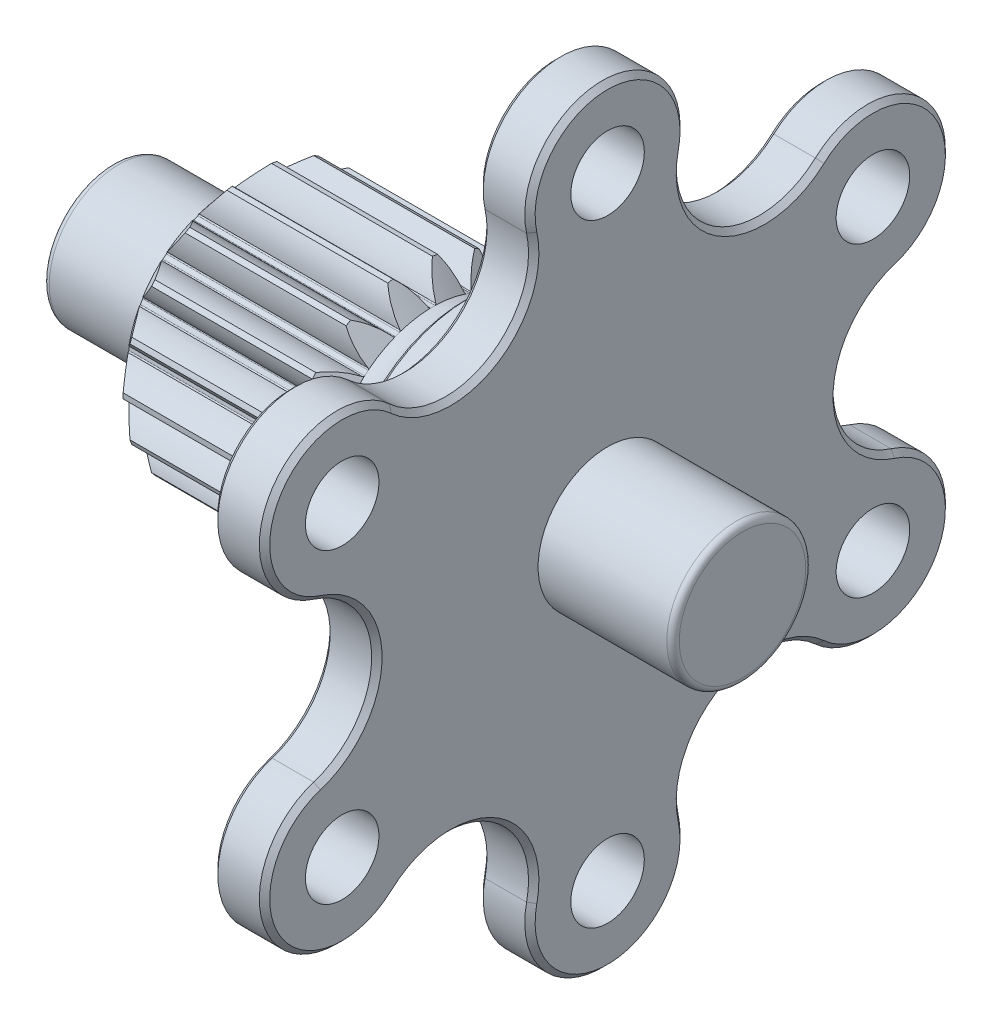
from build123d import *
from OCP.BRepFilletAPI import BRepFilletAPI_MakeChamfer

# Parameters (mm, degrees)
SKETCH1_R              = 47
BASE_EXTRUDE_DEPTH     = 6.35
M8_CLEARANCE_HOLES_D   = 9
CIRPATTERN_COUNT       = 6
CUT_EXTRUDE_DEPTH      = 67.770670957
CUT_EXTRUDE_DEPTH_BACK = 67.770670957
CHAMFER1_SIZE          = 0.635
SKETCH8_R              = 15.748
SHAFT_EXTRUDE_DEPTH    = 52.5820005
CHAMFER3_SIZE          = 0.635
SHAFT_CHAMFER_SIZE     = 1
CUT_EXTRUDE1_START     = -12.856999432
SKETCH45_R             = 15.748
SKETCH45_R_2           = 8.5127
CUT_EXTRUDE1_DEPTH     = 12.856999432
SKETCH55_R             = 8.5
BOSS_EXTRUDE4_DEPTH    = 16.51
SKETCH56_R             = 8.5127
BOSS_EXTRUDE5_DEPTH    = 1.643
FILLET9_R              = 1.524
CUT_EXTRUDE17_START    = -25.4
CUT_EXTRUDE17_DEPTH    = 25.4
CHAMFER6_SIZE          = 2.54
CHAMFER6_SIZE2         = 3.027054125
FILLET10_R             = 1.27
FILLET11_R             = 0.762
FILLET12_R             = 0.762
CHAMFER7_SIZE          = 0.508


with BuildPart() as part:
    # Sketch1 → Base-Extrude (new body)
    with BuildSketch(Plane(origin=(0, 0, 0), x_dir=(0, 0, -1), z_dir=(1, 0, 0))):
        Circle(SKETCH1_R)
    extrude(amount=-BASE_EXTRUDE_DEPTH)

    # M8 Clearance Holes (through all)
    with Locations(Plane(origin=(0, 0, 0), x_dir=(0, 0, -1), z_dir=(1, 0, 0))):
        with Locations((0, -37.5)):
            m8_clearance_holes = Hole(M8_CLEARANCE_HOLES_D / 2)

    # CirPattern: M8 Clearance Holes ×6 about axis
    cirpattern_axis = Axis((0, 0, 0), (1, 0, 0))
    for i in range(1, CIRPATTERN_COUNT):
        add(m8_clearance_holes.rotate(cirpattern_axis, i * 360 / CIRPATTERN_COUNT), mode=Mode.SUBTRACT)

    # Sketch19 → Cut-Extrude (cut, two sides: drawn at the far end of the back side and taken through both)
    with BuildSketch(Plane(origin=(0, 0, 0), x_dir=(0, 0, -1), z_dir=(1, 0, 0)).offset(-CUT_EXTRUDE_DEPTH_BACK)):
        with BuildLine():
            ThreePointArc((9.274838239, 35.443941724), (14.114033661, 24.446223401), (26.057934823, 25.754216393))
            ThreePointArc((26.057934823, 25.754216393), (33.921184851, 28.139425108), (40.703194264, 23.499999504))
            ThreePointArc((40.703194264, 23.499999504), (23.500000227, 40.703193847), (-4.7e-08, 47))
            ThreePointArc((-4.7e-08, 47), (7.40886473, 43.446320157), (9.274838239, 35.443941724))
        make_face()
        with BuildLine():
            ThreePointArc((-26.057934823, 25.754216393), (-14.114033661, 24.446223401), (-9.274838239, 35.443941724))
            ThreePointArc((-9.274838239, 35.443941724), (-7.40886476, 43.44632012), (-4.7e-08, 47))
            ThreePointArc((-4.7e-08, 47), (-23.500000787, 40.703193523), (-40.703194863, 23.499998466))
            ThreePointArc((-40.703194863, 23.499998466), (-33.921185443, 28.139425017), (-26.057934823, 25.754216393))
        make_face()
        with BuildLine():
            ThreePointArc((40.703193464, -23.50000089), (47, -8e-07), (40.703194264, 23.499999504))
            ThreePointArc((40.703194264, 23.499999504), (41.33004921, 15.30689472), (35.332773062, 9.689725331))
            ThreePointArc((35.332773062, 9.689725331), (28.228067323, 0), (35.332773062, -9.689725331))
            ThreePointArc((35.332773062, -9.689725331), (41.330049499, -15.306895465), (40.703193464, -23.50000089))
        make_face()
        with BuildLine():
            ThreePointArc((-35.332773062, 9.689725331), (-41.330048992, 15.306894161), (-40.703194863, 23.499998466))
            ThreePointArc((-40.703194863, 23.499998466), (-47, -6.9e-08), (-40.703194794, -23.499998586))
            ThreePointArc((-40.703194794, -23.499998586), (-41.330049018, -15.306894226), (-35.332773062, -9.689725331))
            ThreePointArc((-35.332773062, -9.689725331), (-28.228067323, 0), (-35.332773062, 9.689725331))
        make_face()
        with BuildLine():
            ThreePointArc((-26.057934823, -25.754216393), (-33.921185375, -28.139425028), (-40.703194794, -23.499998586))
            ThreePointArc((-40.703194794, -23.499998586), (-23.500000688, -40.703193581), (4.4e-08, -47))
            ThreePointArc((4.4e-08, -47), (-7.408864732, -43.446320155), (-9.274838239, -35.443941724))
            ThreePointArc((-9.274838239, -35.443941724), (-14.114033661, -24.446223401), (-26.057934823, -25.754216393))
        make_face()
        with BuildLine():
            ThreePointArc((4.4e-08, -47), (23.499999574, -40.703194224), (40.703193464, -23.50000089))
            ThreePointArc((40.703193464, -23.50000089), (33.92118406, -28.13942523), (26.057934823, -25.754216393))
            ThreePointArc((26.057934823, -25.754216393), (14.114033661, -24.446223401), (9.274838239, -35.443941724))
            ThreePointArc((9.274838239, -35.443941724), (7.408864759, -43.446320121), (4.4e-08, -47))
        make_face()
    extrude(amount=CUT_EXTRUDE_DEPTH + CUT_EXTRUDE_DEPTH_BACK, mode=Mode.SUBTRACT)

    # Chamfer1
    chamfer1_edges = [part.edges().sort_by_distance(p)[0] for p in [
        (-6.35, -24.446223401, 14.114033661),
        (-6.35, 24.446223401, -14.114033661),
        (-6.35, 24.446223401, 14.114033661),
        (-6.35, 23.5, 40.703193978),
        (-6.35, 47, 0),
        (-6.35, -24.446223401, -14.114033661),
        (-6.35, -23.5, -40.703193978),
        (-6.35, -47, 0),
        (-6.35, 0, 28.228067323),
        (-6.35, -23.5, 40.703193978),
        (-6.35, 0, -28.228067323),
        (-6.35, 23.5, -40.703193978),
    ]]
    chamfer(chamfer1_edges, length=CHAMFER1_SIZE)

    # Sketch8 → Shaft-Extrude (add)
    with BuildSketch(Plane.ZY.offset(6.35)):
        with Locations(Location((0, 0, 0), (0, 0, 180))):
            Circle(SKETCH8_R)
    extrude(amount=SHAFT_EXTRUDE_DEPTH)

    # Chamfer3
    chamfer3_edges = [part.edges().sort_by_distance(p)[0] for p in [
        (0, 24.446223401, -14.114033661),
        (0, -24.446223401, 14.114033661),
        (0, -24.446223401, -14.114033661),
        (0, -47, 0),
        (0, -23.5, -40.703193978),
        (0, 24.446223401, 14.114033661),
        (0, 47, 0),
        (0, 23.5, 40.703193978),
        (0, 0, -28.228067323),
        (0, 23.5, -40.703193978),
        (0, 0, 28.228067323),
        (0, -23.5, 40.703193978),
    ]]
    chamfer(chamfer3_edges, length=CHAMFER3_SIZE)

    # Shaft Chamfer
    shaft_chamfer_edges = [part.edges().sort_by_distance(p)[0] for p in [
        (-58.9320005, 0, 15.748),
    ]]
    chamfer(shaft_chamfer_edges, length=SHAFT_CHAMFER_SIZE)

    # Sketch45 → Cut-Extrude1 (cut)
    with BuildSketch(Plane.ZY.offset(58.9320005).offset(CUT_EXTRUDE1_START)):
        with Locations(Location((0, 0, 0), (0, 0, 180))):
            Circle(SKETCH45_R)
        Circle(SKETCH45_R_2, mode=Mode.SUBTRACT)
    extrude(amount=CUT_EXTRUDE1_DEPTH, mode=Mode.SUBTRACT)

    # Sketch55 → Boss-Extrude4 (add)
    with BuildSketch(Plane(origin=(0, 0, 0), x_dir=(0, 0, -1), z_dir=(1, 0, 0))):
        Circle(SKETCH55_R)
    extrude(amount=BOSS_EXTRUDE4_DEPTH)

    # Sketch56 → Boss-Extrude5 (add)
    with BuildSketch(Plane.ZY.offset(58.9320005)):
        Circle(SKETCH56_R)
    extrude(amount=BOSS_EXTRUDE5_DEPTH)

    # Fillet9
    fillet9_edges = [part.edges().sort_by_distance(p)[0] for p in [
        (-46.075001068, 0, -8.5127),
    ]]
    fillet(fillet9_edges, radius=FILLET9_R)

    # Cut-Extrude17: read off the stored shape, not the designer's step
    # Cut-Extrude17 outline → Cut-Extrude17 (cut)
    with BuildSketch(Plane.ZY.offset(46.075001068).offset(CUT_EXTRUDE17_START)):
        with BuildLine():
            ThreePointArc((-14.684667578, 5.688588763), (-12.987779277, 6.048943991), (-11.254165829, 5.986733001))
            ThreePointArc((-11.254165829, 5.986733001), (-11.162537651, 6.019355375), (-11.090657474, 6.084877757))
            ThreePointArc((-11.090657474, 6.084877757), (-10.95542401, 6.325117018), (-10.814987438, 6.562352263))
            ThreePointArc((-10.814987438, 6.562352263), (-10.794183479, 6.657363514), (-10.811745764, 6.753027031))
            ThreePointArc((-10.811745764, 6.753027031), (-11.732428783, 8.223274824), (-12.268796147, 9.873000815))
            ThreePointArc((-12.268796147, 9.873000815), (-13.63816805, 7.874000015), (-14.684667578, 5.688588763))
        make_face()
        with BuildLine():
            ThreePointArc((-12.469388985, 2.647934833), (-13.837402385, 3.714623697), (-14.905662359, 5.081410594))
            ThreePointArc((-14.905662359, 5.081410594), (-15.508752491, 2.73461152), (-15.744685706, 0.323072774))
            ThreePointArc((-15.744685706, 0.323072774), (-14.273381038, 1.242065902), (-12.623039862, 1.776537414))
            ThreePointArc((-12.623039862, 1.776537414), (-12.548095048, 1.8385311), (-12.50295975, 1.924686467))
            ThreePointArc((-12.50295975, 1.924686467), (-12.458048528, 2.196690097), (-12.407220551, 2.467650443))
            ThreePointArc((-12.407220551, 2.467650443), (-12.420166986, 2.564047187), (-12.469388985, 2.647934833))
        make_face()
        with BuildLine():
            ThreePointArc((-8.152132052, 13.473761428), (-10.122619264, 12.063667902), (-11.853461818, 10.367976993))
            ThreePointArc((-11.853461818, 10.367976993), (-10.135659657, 10.126230162), (-8.527873304, 9.474840233))
            ThreePointArc((-8.527873304, 9.474840233), (-8.430613472, 9.474156555), (-8.340658225, 9.511142985))
            ThreePointArc((-8.340658225, 9.511142985), (-8.13141367, 9.690641477), (-7.918307228, 9.865537551))
            ThreePointArc((-7.918307228, 9.865537551), (-7.86626214, 9.947703548), (-7.850046439, 10.043604504))
            ThreePointArc((-7.850046439, 10.043604504), (-8.212351117, 11.740077645), (-8.152132052, 13.473761428))
        make_face()
        with BuildLine():
            ThreePointArc((-12.623039866, -1.776537385), (-14.273381041, -1.24206587), (-15.744685707, -0.323072738))
            ThreePointArc((-15.744685707, -0.323072738), (-15.508752498, -2.734611484), (-14.905662371, -5.08141056))
            ThreePointArc((-14.905662371, -5.08141056), (-13.837402393, -3.714623666), (-12.469388991, -2.647934805))
            ThreePointArc((-12.469388991, -2.647934805), (-12.420166992, -2.564047159), (-12.407220557, -2.467650415))
            ThreePointArc((-12.407220557, -2.467650415), (-12.458048533, -2.196690069), (-12.502959755, -1.924686439))
            ThreePointArc((-12.502959755, -1.924686439), (-12.548095052, -1.838531072), (-12.623039866, -1.776537385))
        make_face()
        with BuildLine():
            ThreePointArc((-3.052200518, 15.449387561), (-5.3861332, 14.798279398), (-7.592553624, 13.796834183))
            ThreePointArc((-7.592553624, 13.796834183), (-6.061029895, 12.982143528), (-4.7729934, 11.8201419))
            ThreePointArc((-4.7729934, 11.8201419), (-4.681832885, 11.786234631), (-4.5846525, 11.790224))
            ThreePointArc((-4.5846525, 11.790224), (-4.326634836, 11.887331556), (-4.066562304, 11.978793409))
            ThreePointArc((-4.066562304, 11.978793409), (-3.989553493, 12.038203723), (-3.941515659, 12.122775047))
            ThreePointArc((-3.941515659, 12.122775047), (-3.701742705, 13.840853836), (-3.052200518, 15.449387561))
        make_face()
        with BuildLine():
            ThreePointArc((-11.254165843, -5.986732975), (-12.987779291, -6.048943962), (-14.684667591, -5.68858873))
            ThreePointArc((-14.684667591, -5.68858873), (-13.638168068, -7.873999984), (-12.26879617, -9.873000787))
            ThreePointArc((-12.26879617, -9.873000787), (-11.732428801, -8.223274797), (-10.811745779, -6.753027006))
            ThreePointArc((-10.811745779, -6.753027006), (-10.794183495, -6.657363489), (-10.814987453, -6.562352239))
            ThreePointArc((-10.814987453, -6.562352239), (-10.955424024, -6.325116993), (-11.090657488, -6.084877731))
            ThreePointArc((-11.090657488, -6.084877731), (-11.162537665, -6.01935535), (-11.254165843, -5.986732975))
        make_face()
        with BuildLine():
            ThreePointArc((2.415871444, 15.561589545), (1.8e-08, 15.748), (-2.415871408, 15.561589551))
            ThreePointArc((-2.415871408, 15.561589551), (-1.255350476, 14.272218789), (-0.44242005, 12.739760007))
            ThreePointArc((-0.44242005, 12.739760007), (-0.368354156, 12.676718864), (-0.275670021, 12.647229995))
            ThreePointArc((-0.275670021, 12.647229995), (1.5e-08, 12.65023401), (0.27567005, 12.647229995))
            ThreePointArc((0.27567005, 12.647229995), (0.368354185, 12.676718863), (0.442420079, 12.739760006))
            ThreePointArc((0.442420079, 12.739760006), (1.255350509, 14.272218786), (2.415871444, 15.561589545))
        make_face()
        with BuildLine():
            ThreePointArc((-8.527873325, -9.474840214), (-10.135659679, -10.126230139), (-11.853461841, -10.367976966))
            ThreePointArc((-11.853461841, -10.367976966), (-10.122619291, -12.063667879), (-8.152132082, -13.473761409))
            ThreePointArc((-8.152132082, -13.473761409), (-8.212351144, -11.740077626), (-7.850046462, -10.043604486))
            ThreePointArc((-7.850046462, -10.043604486), (-7.866262163, -9.94770353), (-7.91830725, -9.865537533))
            ThreePointArc((-7.91830725, -9.865537533), (-8.131413692, -9.690641459), (-8.340658247, -9.511142966))
            ThreePointArc((-8.340658247, -9.511142966), (-8.430613493, -9.474156536), (-8.527873325, -9.474840214))
        make_face()
        with BuildLine():
            ThreePointArc((7.592553655, 13.796834166), (5.386133234, 14.798279386), (3.052200553, 15.449387554))
            ThreePointArc((3.052200553, 15.449387554), (3.701742737, 13.840853828), (3.941515687, 12.122775038))
            ThreePointArc((3.941515687, 12.122775038), (3.98955352, 12.038203713), (4.066562331, 11.9787934))
            ThreePointArc((4.066562331, 11.9787934), (4.326634863, 11.887331546), (4.584652527, 11.79022399))
            ThreePointArc((4.584652527, 11.79022399), (4.681832912, 11.78623462), (4.772993427, 11.820141889))
            ThreePointArc((4.772993427, 11.820141889), (6.061029924, 12.982143514), (7.592553655, 13.796834166))
        make_face()
        with BuildLine():
            ThreePointArc((-4.772993427, -11.820141889), (-6.061029924, -12.982143514), (-7.592553655, -13.796834166))
            ThreePointArc((-7.592553655, -13.796834166), (-5.386133234, -14.798279386), (-3.052200553, -15.449387554))
            ThreePointArc((-3.052200553, -15.449387554), (-3.701742737, -13.840853828), (-3.941515687, -12.122775038))
            ThreePointArc((-3.941515687, -12.122775038), (-3.98955352, -12.038203713), (-4.066562331, -11.9787934))
            ThreePointArc((-4.066562331, -11.9787934), (-4.326634863, -11.887331546), (-4.584652527, -11.79022399))
            ThreePointArc((-4.584652527, -11.79022399), (-4.681832912, -11.78623462), (-4.772993427, -11.820141889))
        make_face()
        with BuildLine():
            ThreePointArc((11.853461841, 10.367976966), (10.122619291, 12.063667879), (8.152132082, 13.473761409))
            ThreePointArc((8.152132082, 13.473761409), (8.212351144, 11.740077626), (7.850046462, 10.043604486))
            ThreePointArc((7.850046462, 10.043604486), (7.866262163, 9.94770353), (7.91830725, 9.865537533))
            ThreePointArc((7.91830725, 9.865537533), (8.131413692, 9.690641459), (8.340658247, 9.511142966))
            ThreePointArc((8.340658247, 9.511142966), (8.430613493, 9.474156536), (8.527873325, 9.474840214))
            ThreePointArc((8.527873325, 9.474840214), (10.135659679, 10.126230139), (11.853461841, 10.367976966))
        make_face()
        with BuildLine():
            ThreePointArc((-0.442420079, -12.739760006), (-1.255350509, -14.272218786), (-2.415871444, -15.561589545))
            ThreePointArc((-2.415871444, -15.561589545), (-1.8e-08, -15.748), (2.415871408, -15.561589551))
            ThreePointArc((2.415871408, -15.561589551), (1.255350476, -14.272218789), (0.44242005, -12.739760007))
            ThreePointArc((0.44242005, -12.739760007), (0.368354156, -12.676718864), (0.275670021, -12.647229995))
            ThreePointArc((0.275670021, -12.647229995), (-1.5e-08, -12.65023401), (-0.27567005, -12.647229995))
            ThreePointArc((-0.27567005, -12.647229995), (-0.368354185, -12.676718863), (-0.442420079, -12.739760006))
        make_face()
        with BuildLine():
            ThreePointArc((14.684667591, 5.68858873), (13.638168068, 7.873999984), (12.26879617, 9.873000787))
            ThreePointArc((12.26879617, 9.873000787), (11.732428801, 8.223274797), (10.811745779, 6.753027006))
            ThreePointArc((10.811745779, 6.753027006), (10.794183495, 6.657363489), (10.814987453, 6.562352239))
            ThreePointArc((10.814987453, 6.562352239), (10.955424024, 6.325116993), (11.090657488, 6.084877731))
            ThreePointArc((11.090657488, 6.084877731), (11.162537665, 6.01935535), (11.254165843, 5.986732975))
            ThreePointArc((11.254165843, 5.986732975), (12.987779291, 6.048943962), (14.684667591, 5.68858873))
        make_face()
        with BuildLine():
            ThreePointArc((3.941515659, -12.122775047), (3.701742705, -13.840853836), (3.052200518, -15.449387561))
            ThreePointArc((3.052200518, -15.449387561), (5.3861332, -14.798279398), (7.592553624, -13.796834183))
            ThreePointArc((7.592553624, -13.796834183), (6.061029895, -12.982143528), (4.7729934, -11.8201419))
            ThreePointArc((4.7729934, -11.8201419), (4.681832885, -11.786234631), (4.5846525, -11.790224))
            ThreePointArc((4.5846525, -11.790224), (4.326634836, -11.887331556), (4.066562304, -11.978793409))
            ThreePointArc((4.066562304, -11.978793409), (3.989553493, -12.038203723), (3.941515659, -12.122775047))
        make_face()
        with BuildLine():
            ThreePointArc((15.744685707, 0.323072738), (15.508752498, 2.734611484), (14.905662371, 5.08141056))
            ThreePointArc((14.905662371, 5.08141056), (13.837402393, 3.714623666), (12.469388991, 2.647934805))
            ThreePointArc((12.469388991, 2.647934805), (12.420166992, 2.564047159), (12.407220557, 2.467650415))
            ThreePointArc((12.407220557, 2.467650415), (12.458048533, 2.196690069), (12.502959755, 1.924686439))
            ThreePointArc((12.502959755, 1.924686439), (12.548095052, 1.838531072), (12.623039866, 1.776537385))
            ThreePointArc((12.623039866, 1.776537385), (14.273381041, 1.24206587), (15.744685707, 0.323072738))
        make_face()
        with BuildLine():
            ThreePointArc((7.850046439, -10.043604504), (8.212351117, -11.740077645), (8.152132052, -13.473761428))
            ThreePointArc((8.152132052, -13.473761428), (10.122619264, -12.063667902), (11.853461818, -10.367976993))
            ThreePointArc((11.853461818, -10.367976993), (10.135659657, -10.126230162), (8.527873304, -9.474840233))
            ThreePointArc((8.527873304, -9.474840233), (8.430613472, -9.474156555), (8.340658225, -9.511142985))
            ThreePointArc((8.340658225, -9.511142985), (8.13141367, -9.690641477), (7.918307228, -9.865537551))
            ThreePointArc((7.918307228, -9.865537551), (7.86626214, -9.947703548), (7.850046439, -10.043604504))
        make_face()
        with BuildLine():
            ThreePointArc((14.905662359, -5.081410594), (15.508752491, -2.73461152), (15.744685706, -0.323072774))
            ThreePointArc((15.744685706, -0.323072774), (14.273381038, -1.242065902), (12.623039862, -1.776537414))
            ThreePointArc((12.623039862, -1.776537414), (12.548095048, -1.8385311), (12.50295975, -1.924686467))
            ThreePointArc((12.50295975, -1.924686467), (12.458048528, -2.196690097), (12.407220551, -2.467650443))
            ThreePointArc((12.407220551, -2.467650443), (12.420166986, -2.564047187), (12.469388985, -2.647934833))
            ThreePointArc((12.469388985, -2.647934833), (13.837402385, -3.714623697), (14.905662359, -5.081410594))
        make_face()
        with BuildLine():
            ThreePointArc((10.811745764, -6.753027031), (11.732428783, -8.223274824), (12.268796147, -9.873000815))
            ThreePointArc((12.268796147, -9.873000815), (13.63816805, -7.874000015), (14.684667578, -5.688588763))
            ThreePointArc((14.684667578, -5.688588763), (12.987779277, -6.048943991), (11.254165829, -5.986733001))
            ThreePointArc((11.254165829, -5.986733001), (11.162537651, -6.019355375), (11.090657474, -6.084877757))
            ThreePointArc((11.090657474, -6.084877757), (10.95542401, -6.325117018), (10.814987438, -6.562352263))
            ThreePointArc((10.814987438, -6.562352263), (10.794183479, -6.657363514), (10.811745764, -6.753027031))
        make_face()
    extrude(amount=CUT_EXTRUDE17_DEPTH, mode=Mode.SUBTRACT)

    # Sketch94 → Cut-Revolve2 (revolve, cut)
    with BuildSketch(Plane.XY, mode=Mode.PRIVATE) as cut_revolve2_sk:
        with BuildLine():
            Line((-21.383096822, 12.652967625), (-23.850001068, 15.748))
            Line((-23.850001068, 15.748), (-17.500001068, 15.748))
            ThreePointArc((-17.500001068, 15.748), (-18.429937038, 13.50293597), (-20.675001068, 12.573))
            ThreePointArc((-20.675001068, 12.573), (-21.031299545, 12.593055247), (-21.383096822, 12.652967625))
        make_face()
    revolve(cut_revolve2_sk.sketch.rotate(Axis((-47.599001068, 0, 0), (-1, 0, 0)), 90), axis=Axis((-47.599001068, 0, 0), (-1, 0, 0)), mode=Mode.SUBTRACT)

    # Chamfer6: one chamfer whose edges measure the first distance from different faces: ONE call of the kernel's chamfer builder (chamfer() names one face for all edges)
    chamfer6_edges_1 = [part.edges().sort_by_distance(p)[0] for p in [
        (-46.075001068, 15.508752498, -2.734611484),
    ]]
    chamfer6_side_1 = [part.faces().sort_by_distance(p)[0] for p in [
        (-34.962501068, 15.508752498, -2.734611484),
    ]]
    chamfer6_edges_2 = [part.edges().sort_by_distance(p)[0] for p in [
        (-46.075001068, 13.638168068, -7.873999985),
    ]]
    chamfer6_side_2 = [part.faces().sort_by_distance(p)[0] for p in [
        (-34.962501068, 13.638168068, -7.873999985),
    ]]
    chamfer6_edges_3 = [part.edges().sort_by_distance(p)[0] for p in [
        (-46.075001068, 10.122619291, -12.063667879),
    ]]
    chamfer6_side_3 = [part.faces().sort_by_distance(p)[0] for p in [
        (-34.962501068, 10.122619291, -12.063667879),
    ]]
    chamfer6_edges_4 = [part.edges().sort_by_distance(p)[0] for p in [
        (-46.075001068, 5.386133234, -14.798279386),
    ]]
    chamfer6_side_4 = [part.faces().sort_by_distance(p)[0] for p in [
        (-34.962501068, 5.386133234, -14.798279386),
    ]]
    chamfer6_edges_5 = [part.edges().sort_by_distance(p)[0] for p in [
        (-46.075001068, 1.8e-08, -15.748),
    ]]
    chamfer6_side_5 = [part.faces().sort_by_distance(p)[0] for p in [
        (-34.962501068, 1.8e-08, -15.748),
    ]]
    chamfer6_edges_6 = [part.edges().sort_by_distance(p)[0] for p in [
        (-46.075001068, -5.3861332, -14.798279398),
    ]]
    chamfer6_side_6 = [part.faces().sort_by_distance(p)[0] for p in [
        (-34.962501068, -5.3861332, -14.798279398),
    ]]
    chamfer6_edges_7 = [part.edges().sort_by_distance(p)[0] for p in [
        (-46.075001068, -10.122619263, -12.063667902),
    ]]
    chamfer6_side_7 = [part.faces().sort_by_distance(p)[0] for p in [
        (-34.962501068, -10.122619263, -12.063667902),
    ]]
    chamfer6_edges_8 = [part.edges().sort_by_distance(p)[0] for p in [
        (-46.075001068, -13.63816805, -7.874000015),
    ]]
    chamfer6_side_8 = [part.faces().sort_by_distance(p)[0] for p in [
        (-34.962501068, -13.63816805, -7.874000015),
    ]]
    chamfer6_edges_9 = [part.edges().sort_by_distance(p)[0] for p in [
        (-46.075001068, -15.508752491, -2.73461152),
    ]]
    chamfer6_side_9 = [part.faces().sort_by_distance(p)[0] for p in [
        (-34.962501068, -15.508752491, -2.73461152),
    ]]
    chamfer6_edges_10 = [part.edges().sort_by_distance(p)[0] for p in [
        (-46.075001068, -15.508752498, 2.734611484),
    ]]
    chamfer6_side_10 = [part.faces().sort_by_distance(p)[0] for p in [
        (-34.962501068, -15.508752498, 2.734611484),
    ]]
    chamfer6_edges_11 = [part.edges().sort_by_distance(p)[0] for p in [
        (-46.075001068, -13.638168068, 7.873999985),
    ]]
    chamfer6_side_11 = [part.faces().sort_by_distance(p)[0] for p in [
        (-34.962501068, -13.638168068, 7.873999985),
    ]]
    chamfer6_edges_12 = [part.edges().sort_by_distance(p)[0] for p in [
        (-46.075001068, -10.122619291, 12.063667879),
    ]]
    chamfer6_side_12 = [part.faces().sort_by_distance(p)[0] for p in [
        (-34.962501068, -10.122619291, 12.063667879),
    ]]
    chamfer6_edges_13 = [part.edges().sort_by_distance(p)[0] for p in [
        (-46.075001068, -5.386133234, 14.798279386),
    ]]
    chamfer6_side_13 = [part.faces().sort_by_distance(p)[0] for p in [
        (-34.962501068, -5.386133234, 14.798279386),
    ]]
    chamfer6_edges_14 = [part.edges().sort_by_distance(p)[0] for p in [
        (-46.075001068, -1.8e-08, 15.748),
    ]]
    chamfer6_side_14 = [part.faces().sort_by_distance(p)[0] for p in [
        (-34.962501068, -1.8e-08, 15.748),
    ]]
    chamfer6_edges_15 = [part.edges().sort_by_distance(p)[0] for p in [
        (-46.075001068, 5.3861332, 14.798279398),
    ]]
    chamfer6_side_15 = [part.faces().sort_by_distance(p)[0] for p in [
        (-34.962501068, 5.3861332, 14.798279398),
    ]]
    chamfer6_edges_16 = [part.edges().sort_by_distance(p)[0] for p in [
        (-46.075001068, 10.122619263, 12.063667902),
    ]]
    chamfer6_side_16 = [part.faces().sort_by_distance(p)[0] for p in [
        (-34.962501068, 10.122619263, 12.063667902),
    ]]
    chamfer6_edges_17 = [part.edges().sort_by_distance(p)[0] for p in [
        (-46.075001068, 13.63816805, 7.874000015),
    ]]
    chamfer6_side_17 = [part.faces().sort_by_distance(p)[0] for p in [
        (-34.962501068, 13.63816805, 7.874000015),
    ]]
    chamfer6_edges_18 = [part.edges().sort_by_distance(p)[0] for p in [
        (-46.075001068, 15.508752491, 2.73461152),
    ]]
    chamfer6_side_18 = [part.faces().sort_by_distance(p)[0] for p in [
        (-34.962501068, 15.508752491, 2.73461152),
    ]]
    chamfer6 = BRepFilletAPI_MakeChamfer(part.part.solid().wrapped)
    for e in chamfer6_edges_1:
        chamfer6.Add(CHAMFER6_SIZE, CHAMFER6_SIZE2, e.wrapped, chamfer6_side_1[0].wrapped)  # the first distance lies on this face
    for e in chamfer6_edges_2:
        chamfer6.Add(CHAMFER6_SIZE, CHAMFER6_SIZE2, e.wrapped, chamfer6_side_2[0].wrapped)  # the first distance lies on this face
    for e in chamfer6_edges_3:
        chamfer6.Add(CHAMFER6_SIZE, CHAMFER6_SIZE2, e.wrapped, chamfer6_side_3[0].wrapped)  # the first distance lies on this face
    for e in chamfer6_edges_4:
        chamfer6.Add(CHAMFER6_SIZE, CHAMFER6_SIZE2, e.wrapped, chamfer6_side_4[0].wrapped)  # the first distance lies on this face
    for e in chamfer6_edges_5:
        chamfer6.Add(CHAMFER6_SIZE, CHAMFER6_SIZE2, e.wrapped, chamfer6_side_5[0].wrapped)  # the first distance lies on this face
    for e in chamfer6_edges_6:
        chamfer6.Add(CHAMFER6_SIZE, CHAMFER6_SIZE2, e.wrapped, chamfer6_side_6[0].wrapped)  # the first distance lies on this face
    for e in chamfer6_edges_7:
        chamfer6.Add(CHAMFER6_SIZE, CHAMFER6_SIZE2, e.wrapped, chamfer6_side_7[0].wrapped)  # the first distance lies on this face
    for e in chamfer6_edges_8:
        chamfer6.Add(CHAMFER6_SIZE, CHAMFER6_SIZE2, e.wrapped, chamfer6_side_8[0].wrapped)  # the first distance lies on this face
    for e in chamfer6_edges_9:
        chamfer6.Add(CHAMFER6_SIZE, CHAMFER6_SIZE2, e.wrapped, chamfer6_side_9[0].wrapped)  # the first distance lies on this face
    for e in chamfer6_edges_10:
        chamfer6.Add(CHAMFER6_SIZE, CHAMFER6_SIZE2, e.wrapped, chamfer6_side_10[0].wrapped)  # the first distance lies on this face
    for e in chamfer6_edges_11:
        chamfer6.Add(CHAMFER6_SIZE, CHAMFER6_SIZE2, e.wrapped, chamfer6_side_11[0].wrapped)  # the first distance lies on this face
    for e in chamfer6_edges_12:
        chamfer6.Add(CHAMFER6_SIZE, CHAMFER6_SIZE2, e.wrapped, chamfer6_side_12[0].wrapped)  # the first distance lies on this face
    for e in chamfer6_edges_13:
        chamfer6.Add(CHAMFER6_SIZE, CHAMFER6_SIZE2, e.wrapped, chamfer6_side_13[0].wrapped)  # the first distance lies on this face
    for e in chamfer6_edges_14:
        chamfer6.Add(CHAMFER6_SIZE, CHAMFER6_SIZE2, e.wrapped, chamfer6_side_14[0].wrapped)  # the first distance lies on this face
    for e in chamfer6_edges_15:
        chamfer6.Add(CHAMFER6_SIZE, CHAMFER6_SIZE2, e.wrapped, chamfer6_side_15[0].wrapped)  # the first distance lies on this face
    for e in chamfer6_edges_16:
        chamfer6.Add(CHAMFER6_SIZE, CHAMFER6_SIZE2, e.wrapped, chamfer6_side_16[0].wrapped)  # the first distance lies on this face
    for e in chamfer6_edges_17:
        chamfer6.Add(CHAMFER6_SIZE, CHAMFER6_SIZE2, e.wrapped, chamfer6_side_17[0].wrapped)  # the first distance lies on this face
    for e in chamfer6_edges_18:
        chamfer6.Add(CHAMFER6_SIZE, CHAMFER6_SIZE2, e.wrapped, chamfer6_side_18[0].wrapped)  # the first distance lies on this face
    add(Compound.cast(chamfer6.Shape()), mode=Mode.REPLACE)

    # Fillet10
    fillet10_edges = [part.edges().sort_by_distance(p)[0] for p in [
        (-6.35, 0, 15.748),
    ]]
    fillet(fillet10_edges, radius=FILLET10_R)

    # Fillet11
    fillet11_edges = [part.edges().sort_by_distance(p)[0] for p in [
        (-60.5750005, 0, -8.5127),
    ]]
    fillet(fillet11_edges, radius=FILLET11_R)

    # Fillet12
    fillet12_edges = [part.edges().sort_by_distance(p)[0] for p in [
        (16.51, 0, 8.5),
    ]]
    fillet(fillet12_edges, radius=FILLET12_R)

    # Chamfer7
    # the kernel refuses this chamfer: 0.508 mm, written as the material it takes off along each edge
    with BuildSketch(Plane(origin=(-17.500001068, 0, 0), x_dir=(0, 0, -1), z_dir=(0, 1, 0))) as chamfer7_piece_1:
        with BuildLine():
            Line((15.748, -CHAMFER7_SIZE), (15.190708024, 0.049291976))
            ThreePointArc((15.190708024, 0.049291976), (15.460461722, 0.013047006), (15.748, 0))
            Line((15.748, 0), (15.748, -CHAMFER7_SIZE))
        make_face()
    revolve(axis=Axis((-17.500001068, 0, 0), (-1, 0, 0)), mode=Mode.SUBTRACT)


solid = part.part
